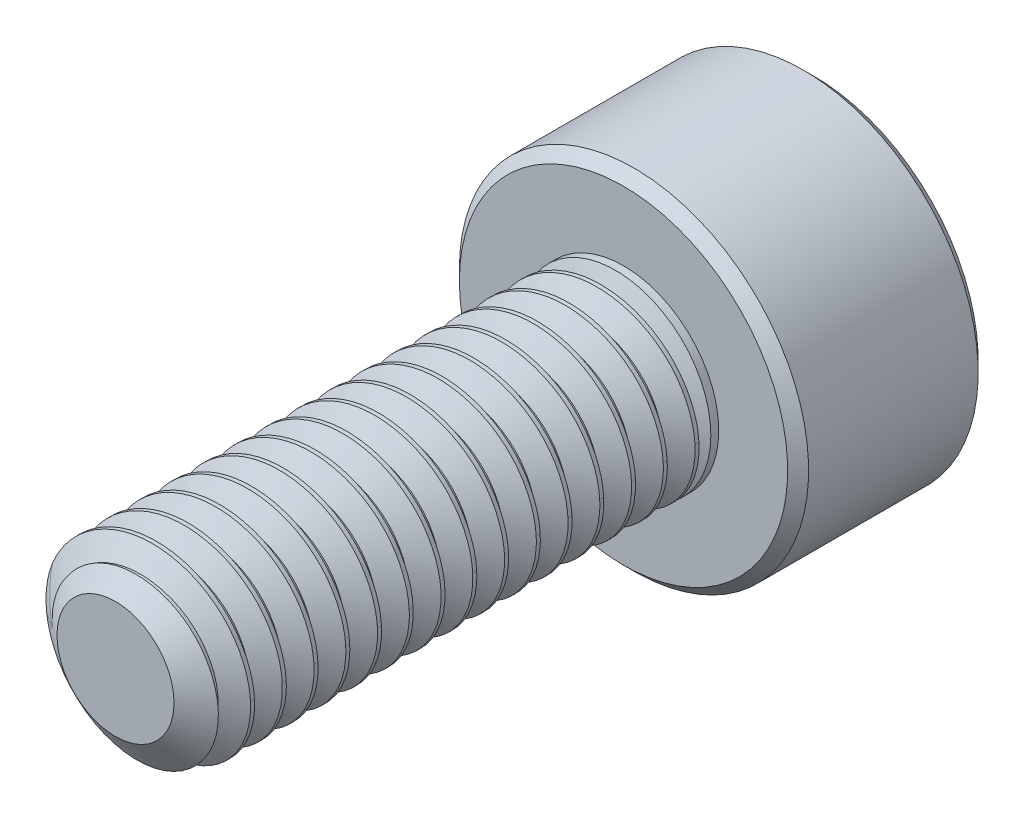
from build123d import *

# Parameters (mm, degrees)
SKETCH1_R          = 1.5
EXTRUDE1_DEPTH     = 8
CUT_SWEEP1_PITCH   = 0.5
SKETCH6_R          = 2.75
EXTRUDE2_DEPTH     = 3
CUT_EXTRUDE1_DEPTH = 1.875
CHAMFER1_SIZE      = 0.165


with BuildPart() as part:
    # Sketch1 → Extrude1 (new body)
    with BuildSketch(Plane.XY):
        Circle(SKETCH1_R)
    extrude(amount=-EXTRUDE1_DEPTH)

    # Cut-Sweep1: arcs per turn and ends read off the stored shape
    # Cut-Sweep1: the profile of Sketch3 profile screwed along a right-hand helix through 19 turns, 6 arcs to a turn; built about Z, then put on its axis
    cut_sweep1_z = Axis((0, 0, 0), (0, 0, 1))
    cut_sweep1_corners = [(1.5003, 0, -0.937673205), (1.175240474, 0, -0.75), (1.175240474, 0, -0.6875), (1.5003, 0, -0.499826795)]
    with BuildLine(mode=Mode.PRIVATE) as cut_sweep1_profile:
        Line(cut_sweep1_corners[0], cut_sweep1_corners[1])
        Line(cut_sweep1_corners[1], cut_sweep1_corners[2])
        Line(cut_sweep1_corners[2], cut_sweep1_corners[3])
        Line(cut_sweep1_corners[3], cut_sweep1_corners[0])
    cut_sweep1_cap = Face(cut_sweep1_profile.wire())
    cut_sweep1_turn_angles = [0, 30, 60, 90, 120, 150, 180, 210, 240, 270, 300, 330, 360]
    cut_sweep1_turn_weights = [1, 0.8660254037844387, 1, 0.8660254037844387, 1, 0.8660254037844387, 1, 0.8660254037844387, 1, 0.8660254037844387, 1, 0.8660254037844387, 1]
    cut_sweep1_turn_rails = [Edge.make_bspline([Vector(p[0], p[1], 0).rotate(cut_sweep1_z, cut_sweep1_turn_angles[k]) / cut_sweep1_turn_weights[k] + Vector(0, 0, p[2] + CUT_SWEEP1_PITCH * cut_sweep1_turn_angles[k] / 360) for k in range(13)], [0, 0, 0, 1, 1, 2, 2, 3, 3, 4, 4, 5, 5, 6, 6, 6], 2, cut_sweep1_turn_weights) for p in cut_sweep1_corners]
    cut_sweep1_turn_sides = [Face.make_surface_from_curves(cut_sweep1_turn_rails[p[0]], cut_sweep1_turn_rails[p[1]]) for p in [(0, 1), (1, 2), (2, 3), (3, 0)]]
    cut_sweep1 = Plane(origin=(0, 0, 0), x_dir=(0, 1, 0), z_dir=(0, 0, -1)) * Solid(Shell([*[p.moved(Location((0, 0, CUT_SWEEP1_PITCH * i))) for i in range(19) for p in cut_sweep1_turn_sides], cut_sweep1_cap, cut_sweep1_cap.rotate(cut_sweep1_z, 6840).moved(Location((0, 0, CUT_SWEEP1_PITCH * 6840 / 360)))]))
    add(cut_sweep1, mode=Mode.SUBTRACT)

    # Sketch4 → Cut-Revolve1 (revolve, cut)
    with BuildSketch(Plane(origin=(0, 0, 0), x_dir=(0, 0, -1), z_dir=(1, 0, 0)), mode=Mode.PRIVATE) as cut_revolve1_sk:
        Polygon((0.405251783, 1.5), (0, 0.921240474), (0, 1.5), align=None)
    revolve(cut_revolve1_sk.sketch.rotate(Axis((0, 0, 0), (0, 0, -1)), 90), axis=Axis((0, 0, 0), (0, 0, -1)), mode=Mode.SUBTRACT)

    # Sketch6 → Extrude2 (add)
    with BuildSketch(Plane(origin=(0, 0, -8), x_dir=(-1, 0, 0), z_dir=(0, 0, -1))):
        Circle(SKETCH6_R)
    extrude(amount=EXTRUDE2_DEPTH)

    # Sketch7 → Cut-Extrude1 (cut)
    with BuildSketch(Plane(origin=(0, 0, -11), x_dir=(-1, 0, 0), z_dir=(0, 0, -1))):
        Polygon((0, 1.443375673), (-1.25, 0.721687836), (-1.25, -0.721687836), (0, -1.443375673), (1.25, -0.721687836), (1.25, 0.721687836), align=None)
    extrude(amount=-CUT_EXTRUDE1_DEPTH, mode=Mode.SUBTRACT)

    # Cut-Extrude2 cone 1 section (through the dimple's axis) → Cut-Extrude2 (revolve, cut)
    with BuildSketch(Plane(origin=(0, 0, -11), x_dir=(0, 1, 0), z_dir=(1, 0, 0))):
        Polygon((0, 0), (1.443375673, 0), (0, 1.443375673), align=None)
    revolve(axis=Axis((0, 0, -11), (0, 0, 1)), mode=Mode.SUBTRACT)

    # Chamfer1
    chamfer1_edges = [part.edges().sort_by_distance(p)[0] for p in [
        (2.75, 0, -8),
        (2.75, 0, -11),
    ]]
    chamfer(chamfer1_edges, length=CHAMFER1_SIZE)

    # Sketch10 → Revolve1 (revolve)
    with BuildSketch(Plane(origin=(0, 0, 0), x_dir=(0, 0, -1), z_dir=(1, 0, 0)), mode=Mode.PRIVATE) as revolve1_sk:
        Polygon((8, 1.5), (8, 0), (7.253679656, 0), (7.875, 1.5), align=None)
    revolve(revolve1_sk.sketch.rotate(Axis((0, 0, -8), (0, 0, 1)), 270), axis=Axis((0, 0, -8), (0, 0, 1)))


solid = part.part
